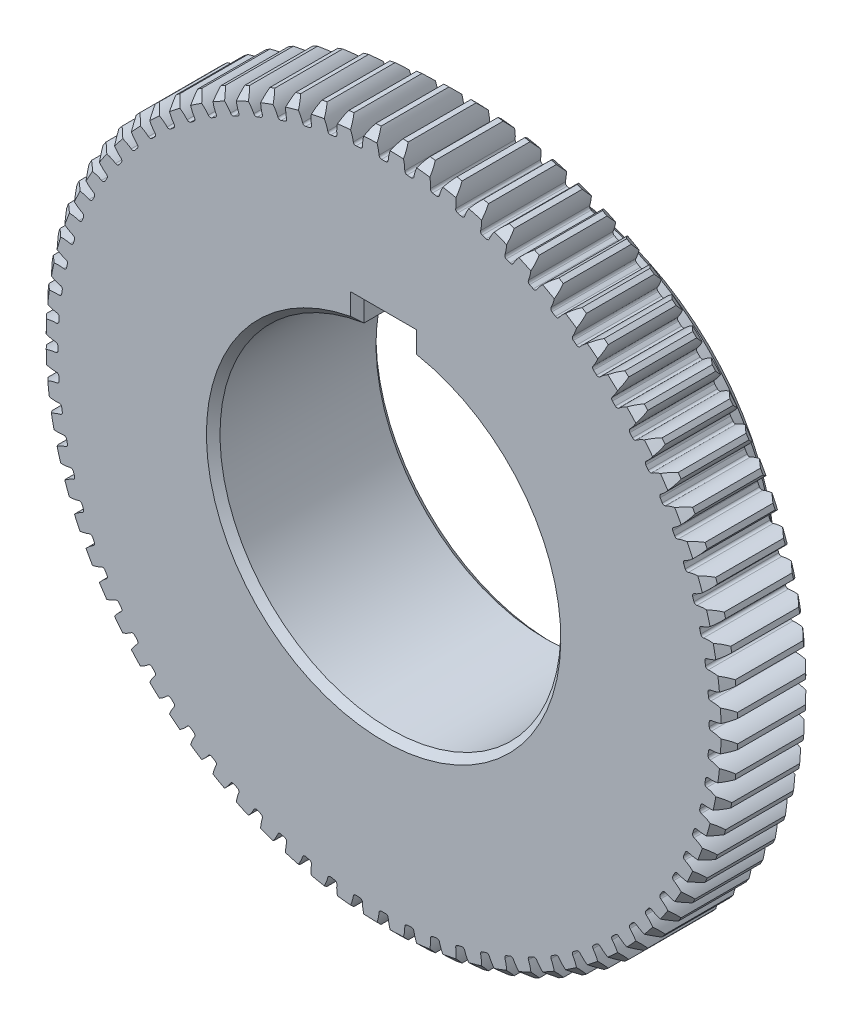
from build123d import *

# Parameters (mm, degrees)
SKETCH2_R                = 40.795
BOSS_EXTRUDE1_DEPTH      = 5
CUT_EXTRUDE1_DEPTH       = 58.909101616
FILLET1_R                = 0.2985
CHAMFER1_SIZE            = 0.995
CIRPATTERN1_COUNT        = 80
FILLET1_OF_CIRPATTERN1_R = 0.2985
SKETCH5_R                = 27
BOSS_EXTRUDE2_DEPTH      = 10
SKETCH6_R                = 20.1
CUT_EXTRUDE3_DEPTH       = 40
SKETCH7_W                = 6.2
SKETCH7_H                = 2.4
CUT_EXTRUDE4_DEPTH       = 62.033757195
CHAMFER2_SIZE            = 0.8
CHAMFER3_SIZE            = 2


with BuildPart() as part:
    # Sketch2 → Boss-Extrude1 (new, symmetric)
    with BuildSketch(Plane.XY):
        Circle(SKETCH2_R)
    extrude(amount=BOSS_EXTRUDE1_DEPTH, both=True)

    # Sketch3 → Cut-Extrude1 (cut, symmetric)
    with BuildSketch(Plane.XY):
        with BuildLine():
            ThreePointArc((-2.226282023, 41.735664525), (-0.988180628, 40.267576444), (-0.526681615, 38.403388594))
            ThreePointArc((-0.526681615, 38.403388594), (0, 38.407), (0.526681615, 38.403388594))
            ThreePointArc((0.526681615, 38.403388594), (0.988180628, 40.267576444), (2.226282023, 41.735664525))
            ThreePointArc((2.226282023, 41.735664525), (0, 41.795), (-2.226282023, 41.735664525))
        make_face()
    cut_extrude1 = extrude(amount=CUT_EXTRUDE1_DEPTH, both=True, mode=Mode.SUBTRACT)

    # Fillet1
    fillet1_edges = [part.edges().sort_by_distance(p)[0] for p in [
        (-0.526681615, 38.403388594, 0),
        (0.526681615, 38.403388594, 0),
    ]]
    fillet(fillet1_edges, radius=FILLET1_R)

    # Chamfer1
    chamfer1_edges = [part.edges().sort_by_distance(p)[0] for p in [
        (-28.38553634, -29.300057196, -5),
        (-28.38553634, -29.300057196, 5),
    ]]
    chamfer(chamfer1_edges, length=CHAMFER1_SIZE)

    # CirPattern1: Cut-Extrude1 ×80 about axis
    cirpattern1_axis = Axis((0, 0, 0), (0, 0, 1))
    for i in range(1, CIRPATTERN1_COUNT):
        add(cut_extrude1.rotate(cirpattern1_axis, i * 360 / CIRPATTERN1_COUNT), mode=Mode.SUBTRACT)

    # Fillet1 of CirPattern1
    fillet1_of_cirpattern1_edges = [part.edges().sort_by_distance(p)[0] for p in [
        (-3.538153173, 38.2436808, 0),
        (-2.48803711, 38.326326726, 0),
        (-6.527810841, 37.848187997, 0),
        (-5.48741626, 38.01297031, 0),
        (-9.477222384, 37.219348529, 0),
        (-8.452963663, 37.465251291, 0),
        (-12.368203699, 36.3610394, 0),
        (-11.366395735, 36.68654654, 0),
        (-15.182930926, 35.278552373, 0),
        (-14.209750197, 35.681657029, 0),
        (-17.904050335, 33.978561338, 0),
        (-16.965496824, 34.456778238, 0),
        (-20.514785319, 32.469081174, 0),
        (-19.616645521, 33.01946195, 0),
        (-22.999039831, 30.759418328, 0),
        (-22.146851076, 31.3785697, 0),
        (-25.341497614, 28.860113439, 0),
        (-24.540513929, 29.544218133, 0),
        (-27.527716637, 26.782876354, 0),
        (-26.782876354, 27.527716637, 0),
        (-29.544218133, 24.540513929, 0),
        (-28.860113439, 25.341497614, 0),
        (-31.3785697, 22.146851076, 0),
        (-30.759418328, 22.999039831, 0),
        (-33.01946195, 19.616645521, 0),
        (-32.469081174, 20.514785319, 0),
        (-34.456778238, 16.965496824, 0),
        (-33.978561338, 17.904050335, 0),
        (-35.681657029, 14.209750197, 0),
        (-35.278552373, 15.182930926, 0),
        (-36.68654654, 11.366395735, 0),
        (-36.3610394, 12.368203699, 0),
        (-37.465251291, 8.452963663, 0),
        (-37.219348529, 9.477222384, 0),
        (-38.01297031, 5.48741626, 0),
        (-37.848187997, 6.527810841, 0),
        (-38.326326726, 2.48803711, 0),
        (-38.2436808, 3.538153173, 0),
        (-38.403388594, -0.526681615, 0),
        (-38.403388594, 0.526681615, 0),
        (-38.2436808, -3.538153173, 0),
        (-38.326326726, -2.48803711, 0),
        (-37.848187997, -6.527810841, 0),
        (-38.01297031, -5.48741626, 0),
        (-37.219348529, -9.477222384, 0),
        (-37.465251291, -8.452963663, 0),
        (-36.3610394, -12.368203699, 0),
        (-36.68654654, -11.366395735, 0),
        (-35.278552373, -15.182930926, 0),
        (-35.681657029, -14.209750197, 0),
        (-33.978561338, -17.904050335, 0),
        (-34.456778238, -16.965496824, 0),
        (-32.469081174, -20.514785319, 0),
        (-33.01946195, -19.616645521, 0),
        (-30.759418328, -22.999039831, 0),
        (-31.3785697, -22.146851076, 0),
        (-28.860113439, -25.341497614, 0),
        (-29.544218133, -24.540513929, 0),
        (-26.782876354, -27.527716637, 0),
        (-27.527716637, -26.782876354, 0),
        (-24.540513929, -29.544218133, 0),
        (-25.341497614, -28.860113439, 0),
        (-22.146851076, -31.3785697, 0),
        (-22.999039831, -30.759418328, 0),
        (-19.616645521, -33.01946195, 0),
        (-20.514785319, -32.469081174, 0),
        (-16.965496824, -34.456778238, 0),
        (-17.904050335, -33.978561338, 0),
        (-14.209750197, -35.681657029, 0),
        (-15.182930926, -35.278552373, 0),
        (-11.366395735, -36.68654654, 0),
        (-12.368203699, -36.3610394, 0),
        (-8.452963663, -37.465251291, 0),
        (-9.477222384, -37.219348529, 0),
        (-5.48741626, -38.01297031, 0),
        (-6.527810841, -37.848187997, 0),
        (-2.48803711, -38.326326726, 0),
        (-3.538153173, -38.2436808, 0),
        (0.526681615, -38.403388594, 0),
        (-0.526681615, -38.403388594, 0),
        (3.538153173, -38.2436808, 0),
        (2.48803711, -38.326326726, 0),
        (6.527810841, -37.848187997, 0),
        (5.48741626, -38.01297031, 0),
        (9.477222384, -37.219348529, 0),
        (8.452963663, -37.465251291, 0),
        (12.368203699, -36.3610394, 0),
        (11.366395735, -36.68654654, 0),
        (15.182930926, -35.278552373, 0),
        (14.209750197, -35.681657029, 0),
        (17.904050335, -33.978561338, 0),
        (16.965496824, -34.456778238, 0),
        (20.514785319, -32.469081174, 0),
        (19.616645521, -33.01946195, 0),
        (22.999039831, -30.759418328, 0),
        (22.146851076, -31.3785697, 0),
        (25.341497614, -28.860113439, 0),
        (24.540513929, -29.544218133, 0),
        (27.527716637, -26.782876354, 0),
        (26.782876354, -27.527716637, 0),
        (29.544218133, -24.540513929, 0),
        (28.860113439, -25.341497614, 0),
        (31.3785697, -22.146851076, 0),
        (30.759418328, -22.999039831, 0),
        (33.01946195, -19.616645521, 0),
        (32.469081174, -20.514785319, 0),
        (34.456778238, -16.965496824, 0),
        (33.978561338, -17.904050335, 0),
        (35.681657029, -14.209750197, 0),
        (35.278552373, -15.182930926, 0),
        (36.68654654, -11.366395735, 0),
        (36.3610394, -12.368203699, 0),
        (37.465251291, -8.452963663, 0),
        (37.219348529, -9.477222384, 0),
        (38.01297031, -5.48741626, 0),
        (37.848187997, -6.527810841, 0),
        (38.326326726, -2.48803711, 0),
        (38.2436808, -3.538153173, 0),
        (38.403388594, 0.526681615, 0),
        (38.403388594, -0.526681615, 0),
        (38.2436808, 3.538153173, 0),
        (38.326326726, 2.48803711, 0),
        (37.848187997, 6.527810841, 0),
        (38.01297031, 5.48741626, 0),
        (37.219348529, 9.477222384, 0),
        (37.465251291, 8.452963663, 0),
        (36.3610394, 12.368203699, 0),
        (36.68654654, 11.366395735, 0),
        (35.278552373, 15.182930926, 0),
        (35.681657029, 14.209750197, 0),
        (33.978561338, 17.904050335, 0),
        (34.456778238, 16.965496824, 0),
        (32.469081174, 20.514785319, 0),
        (33.01946195, 19.616645521, 0),
        (30.759418328, 22.999039831, 0),
        (31.3785697, 22.146851076, 0),
        (28.860113439, 25.341497614, 0),
        (29.544218133, 24.540513929, 0),
        (26.782876354, 27.527716637, 0),
        (27.527716637, 26.782876354, 0),
        (24.540513929, 29.544218133, 0),
        (25.341497614, 28.860113439, 0),
        (22.146851076, 31.3785697, 0),
        (22.999039831, 30.759418328, 0),
        (19.616645521, 33.01946195, 0),
        (20.514785319, 32.469081174, 0),
        (16.965496824, 34.456778238, 0),
        (17.904050335, 33.978561338, 0),
        (14.209750197, 35.681657029, 0),
        (15.182930926, 35.278552373, 0),
        (11.366395735, 36.68654654, 0),
        (12.368203699, 36.3610394, 0),
        (8.452963663, 37.465251291, 0),
        (9.477222384, 37.219348529, 0),
        (5.48741626, 38.01297031, 0),
        (6.527810841, 37.848187997, 0),
        (2.48803711, 38.326326726, 0),
        (3.538153173, 38.2436808, 0),
    ]]
    fillet(fillet1_of_cirpattern1_edges, radius=FILLET1_OF_CIRPATTERN1_R)

    # Sketch5 → Boss-Extrude2 (add)
    with BuildSketch(Plane(origin=(0, 0, -5), x_dir=(-1, 0, 0), z_dir=(0, 0, -1))):
        with Locations(Location((0, 0, 0), (0, 0, 180))):
            Circle(SKETCH5_R)
    extrude(amount=BOSS_EXTRUDE2_DEPTH)

    # Sketch6 → Cut-Extrude3 (cut)
    with BuildSketch(Plane.XY.offset(-15)):
        Circle(SKETCH6_R)
    extrude(amount=CUT_EXTRUDE3_DEPTH, mode=Mode.SUBTRACT)

    # Sketch7 → Cut-Extrude4 (cut, through all)
    with BuildSketch(Plane(origin=(0, 0, -15), x_dir=(-1, 0, 0), z_dir=(0, 0, -1))):
        with Locations((0, 21.05950654)):
            Rectangle(SKETCH7_W, SKETCH7_H)
    extrude(amount=-CUT_EXTRUDE4_DEPTH, mode=Mode.SUBTRACT)

    # Chamfer2
    chamfer2_edges = [part.edges().sort_by_distance(p)[0] for p in [
        (-27, 0, -15),
        (0, -20.1, 5),
        (0, -20.1, -15),
        (-3.1, 21.05950654, 5),
        (3.1, 21.05950654, 5),
        (0, 22.25950654, 5),
        (-3.1, 21.05950654, -15),
        (0, 22.25950654, -15),
        (3.1, 21.05950654, -15),
    ]]
    chamfer(chamfer2_edges, length=CHAMFER2_SIZE)

    # Chamfer3
    chamfer3_edges = [part.edges().sort_by_distance(p)[0] for p in [
        (-27, 0, -5),
    ]]
    chamfer(chamfer3_edges, length=CHAMFER3_SIZE)


solid = part.part
